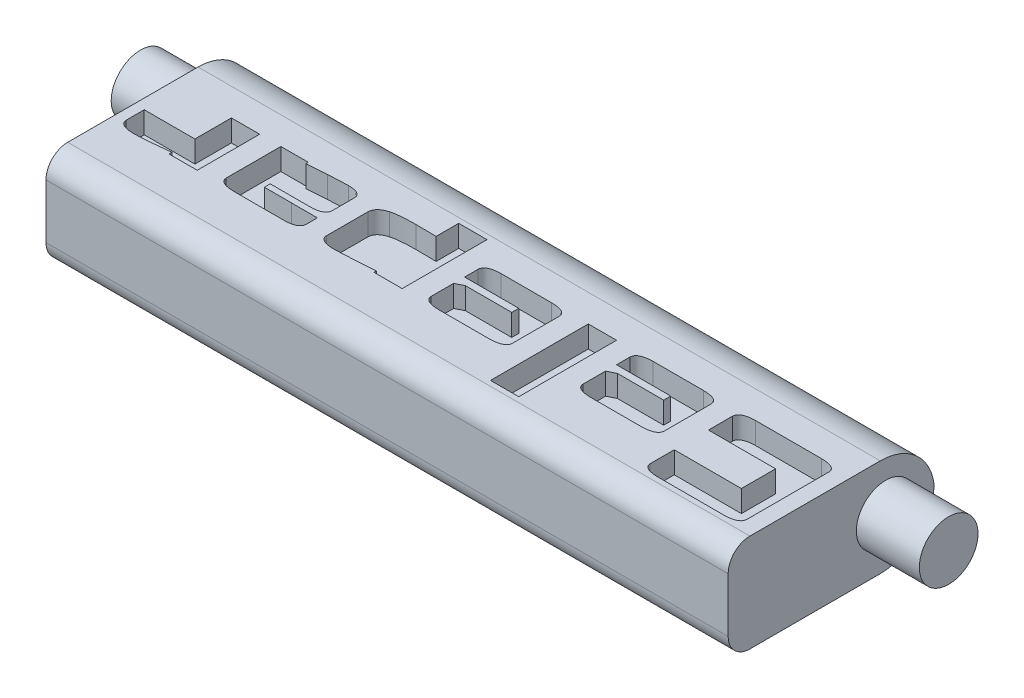
from build123d import *

# Parameters (mm, degrees)
SKETCH1_W           = 31.4
SKETCH1_H           = 9.5
BOSS_EXTRUDE1_DEPTH = 4.5
SKETCH2_R           = 1.35
BOSS_EXTRUDE2_DEPTH = 2.9
BOSS_EXTRUDE3_START = 2.9
SKETCH3_R           = 1.35
BOSS_EXTRUDE3_DEPTH = 2.9
FILLET1_R           = 1
FILLET2_R           = 2.5
SKETCH4_W           = 1.246987952
SKETCH4_H           = 0.670933735
SKETCH4_W_2         = 1.301204819
SKETCH4_H_2         = 4.5
CUT_EXTRUDE1_DEPTH  = 1
SKETCH5_W           = 1.734939759
SKETCH5_H           = 0.867469879
SKETCH5_H_2         = 0.86746988
SKETCH5_W_2         = 1.246987952
SKETCH5_H_3         = 0.670933735
SKETCH5_H_4         = 0.487951808
SKETCH5_W_3         = 1.35953898
SKETCH5_H_5         = 1.843373494
SKETCH5_H_6         = 0.93476554
SKETCH5_H_7         = 0.382440564
SKETCH5_W_4         = 1.030120482
SKETCH5_H_8         = 0.650602409
CUT_EXTRUDE2_DEPTH  = 1


with BuildPart() as part:
    # Sketch1 → Boss-Extrude1 (new body)
    with BuildSketch(Plane(origin=(0, 0, 0), x_dir=(1, 0, 0), z_dir=(0, 1, 0))):
        with Locations((15.7, 4.75)):
            Rectangle(SKETCH1_W, SKETCH1_H)
    extrude(amount=BOSS_EXTRUDE1_DEPTH)

    # Sketch2 → Boss-Extrude2 (add)
    with BuildSketch(Plane(origin=(31.4, 0, 0), x_dir=(0, 0, -1), z_dir=(1, 0, 0))):
        with Locations(Location((7.25, 2.25, 0), (0, 0, 180))):
            Circle(SKETCH2_R)
    extrude(amount=BOSS_EXTRUDE2_DEPTH)

    # Sketch3 → Boss-Extrude3 (add)
    with BuildSketch(Plane.ZY.offset(BOSS_EXTRUDE3_START)):
        with Locations((-7.25, 2.25)):
            Circle(SKETCH3_R)
    extrude(amount=-BOSS_EXTRUDE3_DEPTH)

    # Fillet1
    fillet1_edges = [part.edges().sort_by_distance(p)[0] for p in [
        (15.7, 0, 0),
        (15.7, 4.5, 0),
    ]]
    fillet(fillet1_edges, radius=FILLET1_R)

    # Fillet2
    # the kernel refuses this fillet: 2.5 mm, written as the material it takes off along each edge
    with BuildSketch(Plane(origin=(37.65, 0, -9.5), x_dir=(0, 0, 1), z_dir=(-1, 0, 0)), Plane(origin=(37.65, 4.5, -9.5), x_dir=(0, -1, 0), z_dir=(-1, 0, 0))) as fillet2_piece_1:
        with BuildLine():
            CenterArc((FILLET2_R, FILLET2_R), FILLET2_R, 180, 90)
            Line((0, FILLET2_R), (0, 0))
            Line((0, 0), (FILLET2_R, 0))
        make_face()
    extrude(amount=43.9, mode=Mode.SUBTRACT)

    # Sketch4 → Cut-Extrude1 (cut)
    # profile 1 of 7: a face of its own
    with BuildSketch(Plane(origin=(0, 4.5, 0), x_dir=(1, 0, 0), z_dir=(0, 1, 0))):
        with BuildLine():
            add(Edge.make_bspline(
                [(26.218072289, 5.382517539), (26.221243677, 5.409770477), (26.227427724, 5.462912343), (26.26504197, 5.53622592), (26.32404765, 5.597641275), (26.405137995, 5.6464264), (26.505777198, 5.686220711), (26.627818775, 5.713388683), (26.770428969, 5.73200329), (26.872558817, 5.735565362), (26.927127259, 5.737468593)],
                knots=[0, 0, 0, 0, 0.750064438, 1.462588142, 2.221300064, 3.066551887, 4.046496894, 5.188869009, 6.497999949, 8, 8, 8, 8], degree=3))
            Line((26.927127259, 5.737468593), (29.954800452, 5.737468593))
            add(Edge.make_bspline(
                [(29.954800452, 5.737468593), (30.009368893, 5.735565362), (30.111498742, 5.73200329), (30.254108936, 5.713388683), (30.376150513, 5.686220711), (30.476789715, 5.6464264), (30.557880061, 5.597641275), (30.616885741, 5.53622592), (30.654499987, 5.462912343), (30.660684034, 5.409770477), (30.663855422, 5.382517539)],
                knots=[0, 0, 0, 0, 1.502000051, 2.811130991, 3.953503106, 4.933448113, 5.778699936, 6.537411858, 7.249935562, 8, 8, 8, 8], degree=3))
            Line((30.663855422, 5.382517539), (30.663855422, 1.592419647))
            add(Edge.make_bspline(
                [(30.663855422, 1.592419647), (30.660684034, 1.565166709), (30.654499987, 1.512024842), (30.616885741, 1.438711265), (30.557880061, 1.37729591), (30.476789715, 1.328510786), (30.376150513, 1.288716474), (30.254108936, 1.261548503), (30.111498742, 1.242933896), (30.009368893, 1.239371824), (29.954800452, 1.237468593)],
                knots=[0, 0, 0, 0, 0.750064438, 1.462588142, 2.221300064, 3.066551887, 4.046496894, 5.188869009, 6.497999949, 8, 8, 8, 8], degree=3))
            Line((29.954800452, 1.237468593), (26.927127259, 1.237468593))
            add(Edge.make_bspline(
                [(26.927127259, 1.237468593), (26.872558817, 1.239371824), (26.770428969, 1.242933896), (26.627818775, 1.261548503), (26.505777198, 1.288716474), (26.405137995, 1.328510786), (26.32404765, 1.37729591), (26.26504197, 1.438711265), (26.227427724, 1.512024842), (26.221243677, 1.565166709), (26.218072289, 1.592419647)],
                knots=[0, 0, 0, 0, 1.502000051, 2.811130991, 3.953503106, 4.933448113, 5.778699936, 6.537411858, 7.249935562, 8, 8, 8, 8], degree=3))
            Line((26.218072289, 1.592419647), (26.218072289, 2.701324014))
            Line((26.218072289, 2.701324014), (27.573493976, 2.701324014))
            Line((27.573493976, 2.701324014), (27.573493976, 1.833854135))
            Line((27.573493976, 1.833854135), (29.308433735, 1.833854135))
            Line((29.308433735, 1.833854135), (29.308433735, 5.141083051))
            Line((29.308433735, 5.141083051), (27.573493976, 5.141083051))
            Line((27.573493976, 5.141083051), (27.573493976, 4.273613171))
            Line((27.573493976, 4.273613171), (26.218072289, 4.273613171))
            Line((26.218072289, 4.273613171), (26.218072289, 5.382517539))
        make_face()
    # profile 2 of 7: a face of its own
    with BuildSketch(Plane(origin=(0, 4.5, 0), x_dir=(1, 0, 0), z_dir=(0, 1, 0))):
        with BuildLine():
            add(Edge.make_bspline(
                [(21.501204819, 5.382517539), (21.504376207, 5.409770477), (21.510560254, 5.462912343), (21.5481745, 5.53622592), (21.60718018, 5.597641275), (21.688270526, 5.6464264), (21.788909728, 5.686220711), (21.910951305, 5.713388683), (22.053561499, 5.73200329), (22.155691348, 5.735565362), (22.210259789, 5.737468593)],
                knots=[0, 0, 0, 0, 0.750064438, 1.462588142, 2.221300064, 3.066551887, 4.046496894, 5.188869009, 6.497999949, 8, 8, 8, 8], degree=3))
            Line((22.210259789, 5.737468593), (24.533113705, 5.737468593))
            add(Edge.make_bspline(
                [(24.533113705, 5.737468593), (24.587682146, 5.735565362), (24.689811995, 5.73200329), (24.832422189, 5.713388683), (24.954463766, 5.686220711), (25.055102968, 5.6464264), (25.136193314, 5.597641275), (25.195198994, 5.53622592), (25.23281324, 5.462912343), (25.238997287, 5.409770477), (25.242168675, 5.382517539)],
                knots=[0, 0, 0, 0, 1.502000051, 2.811130991, 3.953503106, 4.933448113, 5.778699936, 6.537411858, 7.249935562, 8, 8, 8, 8], degree=3))
            Line((25.242168675, 5.382517539), (25.242168675, 3.218925671))
            add(Edge.make_bspline(
                [(25.242168675, 3.218925671), (25.238997287, 3.191672733), (25.23281324, 3.138530866), (25.195198994, 3.065217289), (25.136193314, 3.003801934), (25.055102968, 2.95501681), (24.954463766, 2.915222498), (24.832422189, 2.888054527), (24.689811995, 2.86943992), (24.587682146, 2.865877848), (24.533113705, 2.863974617)],
                knots=[0, 0, 0, 0, 0.750064438, 1.462588142, 2.221300064, 3.066551887, 4.046496894, 5.188869009, 6.497999949, 8, 8, 8, 8], degree=3))
            Line((24.533113705, 2.863974617), (22.210259789, 2.863974617))
            add(Edge.make_bspline(
                [(22.210259789, 2.863974617), (22.155691348, 2.865877848), (22.053561499, 2.86943992), (21.910951305, 2.888054527), (21.788909728, 2.915222498), (21.688270526, 2.95501681), (21.60718018, 3.003801934), (21.5481745, 3.065217289), (21.510560254, 3.138530866), (21.504376207, 3.191672733), (21.501204819, 3.218925671)],
                knots=[0, 0, 0, 0, 1.502000051, 2.811130991, 3.953503106, 4.933448113, 5.778699936, 6.537411858, 7.249935562, 8, 8, 8, 8], degree=3))
            Line((21.501204819, 3.218925671), (21.501204819, 4.255823261))
            Line((21.501204819, 4.255823261), (21.862932982, 4.436263773))
            Line((21.862932982, 4.436263773), (23.995180723, 4.436263773))
            Line((23.995180723, 4.436263773), (23.995180723, 5.249516786))
            Line((23.995180723, 5.249516786), (22.748192771, 5.249516786))
            Line((22.748192771, 5.249516786), (22.748192771, 4.761564978))
            Line((22.748192771, 4.761564978), (21.501204819, 4.761564978))
            Line((21.501204819, 4.761564978), (21.501204819, 5.382517539))
        make_face()
        with Locations((23.371686747, 3.687393292)):
            Rectangle(SKETCH4_W, SKETCH4_H, mode=Mode.SUBTRACT)
    # profile 3 of 7: a face of its own
    with BuildSketch(Plane(origin=(0, 4.5, 0), x_dir=(1, 0, 0), z_dir=(0, 1, 0))):
        with Locations((19.874698796, 3.487468593)):
            Rectangle(SKETCH4_W_2, SKETCH4_H_2)
    # profile 4 of 7: a face of its own
    with BuildSketch(Plane(origin=(0, 4.5, 0), x_dir=(1, 0, 0), z_dir=(0, 1, 0))):
        with BuildLine():
            add(Edge.make_bspline(
                [(14.507228916, 5.382517539), (14.510400303, 5.409770477), (14.51658435, 5.462912343), (14.554198596, 5.53622592), (14.613204277, 5.597641275), (14.694294622, 5.6464264), (14.794933824, 5.686220711), (14.916975401, 5.713388683), (15.059585596, 5.73200329), (15.161715444, 5.735565362), (15.216283886, 5.737468593)],
                knots=[0, 0, 0, 0, 0.750064438, 1.462588142, 2.221300064, 3.066551887, 4.046496894, 5.188869009, 6.497999949, 8, 8, 8, 8], degree=3))
            Line((15.216283886, 5.737468593), (17.539137801, 5.737468593))
            add(Edge.make_bspline(
                [(17.539137801, 5.737468593), (17.593706243, 5.735565362), (17.695836091, 5.73200329), (17.838446286, 5.713388683), (17.960487862, 5.686220711), (18.061127065, 5.6464264), (18.14221741, 5.597641275), (18.20122309, 5.53622592), (18.238837337, 5.462912343), (18.245021384, 5.409770477), (18.248192771, 5.382517539)],
                knots=[0, 0, 0, 0, 1.502000051, 2.811130991, 3.953503106, 4.933448113, 5.778699936, 6.537411858, 7.249935562, 8, 8, 8, 8], degree=3))
            Line((18.248192771, 5.382517539), (18.248192771, 3.218925671))
            add(Edge.make_bspline(
                [(18.248192771, 3.218925671), (18.245021384, 3.191672733), (18.238837337, 3.138530866), (18.20122309, 3.065217289), (18.14221741, 3.003801934), (18.061127065, 2.95501681), (17.960487862, 2.915222498), (17.838446286, 2.888054527), (17.695836091, 2.86943992), (17.593706243, 2.865877848), (17.539137801, 2.863974617)],
                knots=[0, 0, 0, 0, 0.750064438, 1.462588142, 2.221300064, 3.066551887, 4.046496894, 5.188869009, 6.497999949, 8, 8, 8, 8], degree=3))
            Line((17.539137801, 2.863974617), (15.216283886, 2.863974617))
            add(Edge.make_bspline(
                [(15.216283886, 2.863974617), (15.161715444, 2.865877848), (15.059585596, 2.86943992), (14.916975401, 2.888054527), (14.794933824, 2.915222498), (14.694294622, 2.95501681), (14.613204277, 3.003801934), (14.554198596, 3.065217289), (14.51658435, 3.138530866), (14.510400303, 3.191672733), (14.507228916, 3.218925671)],
                knots=[0, 0, 0, 0, 1.502000051, 2.811130991, 3.953503106, 4.933448113, 5.778699936, 6.537411858, 7.249935562, 8, 8, 8, 8], degree=3))
            Line((14.507228916, 3.218925671), (14.507228916, 4.255823261))
            Line((14.507228916, 4.255823261), (14.868957078, 4.436263773))
            Line((14.868957078, 4.436263773), (17.001204819, 4.436263773))
            Line((17.001204819, 4.436263773), (17.001204819, 5.249516786))
            Line((17.001204819, 5.249516786), (15.754216867, 5.249516786))
            Line((15.754216867, 5.249516786), (15.754216867, 4.761564978))
            Line((15.754216867, 4.761564978), (14.507228916, 4.761564978))
            Line((14.507228916, 4.761564978), (14.507228916, 5.382517539))
        make_face()
        with Locations((16.377710843, 3.687393292)):
            Rectangle(SKETCH4_W, SKETCH4_H, mode=Mode.SUBTRACT)
    # profile 5 of 7: a face of its own
    with BuildSketch(Plane(origin=(0, 4.5, 0), x_dir=(1, 0, 0), z_dir=(0, 1, 0))):
        with BuildLine():
            add(Edge.make_bspline(
                [(9.681927711, 5.141083051), (9.684473016, 5.169803781), (9.689437018, 5.225816602), (9.715998024, 5.30595032), (9.757368829, 5.378811509), (9.813633899, 5.445206631), (9.885601193, 5.503784906), (9.971593947, 5.556265692), (10.072736272, 5.600950022), (10.145909657, 5.624375221), (10.184280873, 5.636659105)],
                knots=[0, 0, 0, 0, 0.909824727, 1.774392534, 2.646544212, 3.546843563, 4.511186092, 5.570023386, 6.725750396, 8, 8, 8, 8], degree=3))
            add(Edge.make_bspline(
                [(10.184280873, 5.636659105), (10.216667134, 5.644963915), (10.284956827, 5.662475445), (10.394359972, 5.681692891), (10.515118003, 5.700217239), (10.648100433, 5.712817959), (10.792981215, 5.723816039), (10.949714942, 5.732632251), (11.118374928, 5.736255612), (11.234731953, 5.737055245), (11.294879518, 5.737468593)],
                knots=[0, 0, 0, 0, 0.717457957, 1.512832393, 2.382952487, 3.33956523, 4.379103306, 5.5021509, 6.708805593, 8, 8, 8, 8], degree=3))
            add(Edge.make_bspline(
                [(11.294879518, 5.737468593), (11.326506978, 5.737590405), (11.395696292, 5.737856885), (11.508072426, 5.735448711), (11.637976268, 5.73418702), (11.778879534, 5.73167084), (11.917796161, 5.728503299), (12.041501339, 5.728797156), (12.143139315, 5.726053126), (12.203575718, 5.726332907), (12.230120482, 5.726455792)],
                knots=[0, 0, 0, 0, 0.811520535, 1.775310121, 2.883999848, 4.14494234, 5.391395572, 6.449295368, 7.318902409, 8, 8, 8, 8], degree=3))
            Line((12.230120482, 5.726455792), (12.230120482, 6.767589075))
            Line((12.230120482, 6.767589075), (13.531325301, 6.767589075))
            Line((13.531325301, 6.767589075), (13.531325301, 2.863974617))
            Line((13.531325301, 2.863974617), (12.230120482, 2.863974617))
            Line((12.230120482, 2.863974617), (12.230120482, 2.972408352))
            add(Edge.make_bspline(
                [(12.230120482, 2.972408352), (12.076778318, 2.961818358), (11.770053627, 2.940635584), (11.463449999, 2.917767227), (11.310128012, 2.906331545)],
                knots=[0, 0, 0, 0, 0.999868408, 2, 2, 2, 2], degree=3))
            add(Edge.make_bspline(
                [(11.310128012, 2.906331545), (11.262976277, 2.902863305), (11.171239613, 2.896115628), (11.037387729, 2.887596415), (10.911135714, 2.881001645), (10.792536063, 2.875074496), (10.681580703, 2.869748915), (10.577937559, 2.866283182), (10.481913269, 2.864737527), (10.420350447, 2.864221013), (10.390982681, 2.863974617)],
                knots=[0, 0, 0, 0, 1.23296408, 2.398809114, 3.497630202, 4.52988251, 5.495581954, 6.394476552, 7.234105324, 8, 8, 8, 8], degree=3))
            add(Edge.make_bspline(
                [(10.390982681, 2.863974617), (10.336414239, 2.865877848), (10.234284391, 2.86943992), (10.091674196, 2.888054527), (9.969632619, 2.915222498), (9.868993417, 2.95501681), (9.787903072, 3.003801934), (9.728897392, 3.065217289), (9.691283145, 3.138530866), (9.685099098, 3.191672733), (9.681927711, 3.218925671)],
                knots=[0, 0, 0, 0, 1.502000051, 2.811130991, 3.953503106, 4.933448113, 5.778699936, 6.537411858, 7.249935562, 8, 8, 8, 8], degree=3))
            Line((9.681927711, 3.218925671), (9.681927711, 5.141083051))
        make_face()
        with BuildLine():
            Line((10.98313253, 4.979279587), (10.98313253, 3.406143292))
            Line((10.98313253, 3.406143292), (12.230120482, 3.406143292))
            Line((12.230120482, 3.406143292), (12.230120482, 5.195299918))
            Line((12.230120482, 5.195299918), (11.406701807, 5.195299918))
            add(Edge.make_bspline(
                [(11.406701807, 5.195299918), (11.373634124, 5.194736387), (11.311556335, 5.193678473), (11.224972267, 5.183807398), (11.151335376, 5.167553719), (11.090594853, 5.144097299), (11.042742439, 5.113709763), (11.007288968, 5.076050018), (10.986848305, 5.029649942), (10.984396681, 4.996416179), (10.98313253, 4.979279587)],
                knots=[0, 0, 0, 0, 1.499349247, 2.814720501, 3.945555396, 4.911139974, 5.753030106, 6.496525421, 7.22475135, 8, 8, 8, 8], degree=3))
        make_face(mode=Mode.SUBTRACT)
    # profile 6 of 7: a face of its own
    with BuildSketch(Plane(origin=(0, 4.5, 0), x_dir=(1, 0, 0), z_dir=(0, 1, 0))):
        with BuildLine():
            Line((5.073493976, 5.737468593), (6.331494729, 5.737468593))
            Line((6.331494729, 5.737468593), (6.331494729, 5.629034858))
            add(Edge.make_bspline(
                [(6.331494729, 5.629034858), (6.487372876, 5.63998257), (6.799430227, 5.661899139), (7.111431629, 5.684598282), (7.267582831, 5.695958804)],
                knots=[0, 0, 0, 0, 0.999035255, 2, 2, 2, 2], degree=3))
            add(Edge.make_bspline(
                [(7.267582831, 5.695958804), (7.316997852, 5.699087432), (7.412716433, 5.705147693), (7.551931462, 5.713592868), (7.681801382, 5.72138463), (7.802660656, 5.727477923), (7.9142266, 5.731391818), (8.016713951, 5.735185603), (8.109916902, 5.736688218), (8.168938098, 5.737217768), (8.196893825, 5.737468593)],
                knots=[0, 0, 0, 0, 1.277248827, 2.474074539, 3.597753647, 4.63336449, 5.595566971, 6.477435299, 7.278828509, 8, 8, 8, 8], degree=3))
            add(Edge.make_bspline(
                [(8.196893825, 5.737468593), (8.244125827, 5.735530773), (8.333041973, 5.731882748), (8.457140753, 5.713480319), (8.563741962, 5.685894466), (8.651438535, 5.64602658), (8.722408248, 5.596800183), (8.772777723, 5.534614431), (8.806585805, 5.462371297), (8.811776049, 5.409721513), (8.814457831, 5.382517539)],
                knots=[0, 0, 0, 0, 1.435333223, 2.702072664, 3.805190089, 4.768726751, 5.616486771, 6.403039614, 7.174855684, 8, 8, 8, 8], degree=3))
            Line((8.814457831, 5.382517539), (8.814457831, 4.357479888))
            add(Edge.make_bspline(
                [(8.814457831, 4.357479888), (8.811819793, 4.330268124), (8.806702803, 4.277485595), (8.771936848, 4.204756911), (8.718691898, 4.143182369), (8.64521566, 4.093750889), (8.554277148, 4.054198477), (8.44413353, 4.026444654), (8.315512276, 4.008070569), (8.223226279, 4.004456036), (8.174021084, 4.002528834)],
                knots=[0, 0, 0, 0, 0.804248023, 1.559996011, 2.342741836, 3.189471187, 4.159086663, 5.266561659, 6.542580998, 8, 8, 8, 8], degree=3))
            Line((8.174021084, 4.002528834), (6.320481928, 4.002528834))
            Line((6.320481928, 4.002528834), (6.320481928, 3.351926424))
            Line((6.320481928, 3.351926424), (7.56746988, 3.351926424))
            Line((7.56746988, 3.351926424), (7.56746988, 3.731444496))
            Line((7.56746988, 3.731444496), (8.760240964, 3.731444496))
            Line((8.760240964, 3.731444496), (8.760240964, 3.218925671))
            add(Edge.make_bspline(
                [(8.760240964, 3.218925671), (8.757237864, 3.191732982), (8.751417483, 3.139030164), (8.716967928, 3.065938492), (8.662548291, 3.00435628), (8.587488712, 2.955271468), (8.494453974, 2.915336714), (8.38164456, 2.888094788), (8.250003822, 2.869443049), (8.155741284, 2.865878285), (8.105402861, 2.863974617)],
                knots=[0, 0, 0, 0, 0.793056325, 1.537041893, 2.312994797, 3.160093703, 4.129691991, 5.251786666, 6.53238912, 8, 8, 8, 8], degree=3))
            Line((8.105402861, 2.863974617), (5.782548946, 2.863974617))
            add(Edge.make_bspline(
                [(5.782548946, 2.863974617), (5.727980504, 2.865877848), (5.625850656, 2.86943992), (5.483240461, 2.888054527), (5.361198885, 2.915222498), (5.260559682, 2.95501681), (5.179469337, 3.003801934), (5.120463657, 3.065217289), (5.08284941, 3.138530866), (5.076665363, 3.191672733), (5.073493976, 3.218925671)],
                knots=[0, 0, 0, 0, 1.502000051, 2.811130991, 3.953503106, 4.933448113, 5.778699936, 6.537411858, 7.249935562, 8, 8, 8, 8], degree=3))
            Line((5.073493976, 3.218925671), (5.073493976, 5.737468593))
        make_face()
        Polygon((6.320481928, 5.222408352), (6.320481928, 4.436263773), (7.56746988, 4.436263773), (7.56746988, 5.249516786), align=None, mode=Mode.SUBTRACT)
    # profile 7 of 7: a face of its own
    with BuildSketch(Plane(origin=(0, 4.5, 0), x_dir=(1, 0, 0), z_dir=(0, 1, 0))):
        with BuildLine():
            Line((0.465060241, 4.056745701), (1.76626506, 4.056745701))
            Line((1.76626506, 4.056745701), (1.76626506, 3.406143292))
            Line((1.76626506, 3.406143292), (2.796385542, 3.4129204))
            Line((2.796385542, 3.4129204), (2.796385542, 5.737468593))
            Line((2.796385542, 5.737468593), (4.097590361, 5.737468593))
            Line((4.097590361, 5.737468593), (4.097590361, 2.863974617))
            Line((4.097590361, 2.863974617), (2.796385542, 2.863974617))
            Line((2.796385542, 2.863974617), (2.796385542, 2.999516786))
            add(Edge.make_bspline(
                [(2.796385542, 2.999516786), (2.661413984, 2.985060159), (2.392058854, 2.956209884), (2.122633813, 2.928019977), (1.988215361, 2.913955792)],
                knots=[0, 0, 0, 0, 1.002182942, 2, 2, 2, 2], degree=3))
            add(Edge.make_bspline(
                [(1.988215361, 2.913955792), (1.910312664, 2.906214609), (1.761414515, 2.891418616), (1.547837168, 2.876510174), (1.354369543, 2.866385109), (1.232013798, 2.864748879), (1.174115211, 2.863974617)],
                knots=[0, 0, 0, 0, 1.151291896, 2.200504451, 3.148480928, 4, 4, 4, 4], degree=3))
            add(Edge.make_bspline(
                [(1.174115211, 2.863974617), (1.119546769, 2.865877848), (1.017416921, 2.86943992), (0.874806726, 2.888054527), (0.75276515, 2.915222498), (0.652125947, 2.95501681), (0.571035602, 3.003801934), (0.512029922, 3.065217289), (0.474415675, 3.138530866), (0.468231628, 3.191672733), (0.465060241, 3.218925671)],
                knots=[0, 0, 0, 0, 1.502000051, 2.811130991, 3.953503106, 4.933448113, 5.778699936, 6.537411858, 7.249935562, 8, 8, 8, 8], degree=3))
            Line((0.465060241, 3.218925671), (0.465060241, 4.056745701))
        make_face()
    extrude(amount=-CUT_EXTRUDE1_DEPTH, mode=Mode.SUBTRACT)

    # Sketch5 → Cut-Extrude2 (cut)
    with BuildSketch(Plane(origin=(0, 4.5, 0), x_dir=(1, 0, 0), z_dir=(0, 1, 0))):
        with Locations((28.440963856, 2.267589075)):
            Rectangle(SKETCH5_W, SKETCH5_H)
        with Locations((28.440963856, 4.707348111)):
            Rectangle(SKETCH5_W, SKETCH5_H_2)
        with Locations((23.371686747, 3.687393292)):
            Rectangle(SKETCH5_W_2, SKETCH5_H_3)
        with Locations((23.371686747, 5.005540882)):
            Rectangle(SKETCH5_W_2, SKETCH5_H_4)
        with Locations((16.377710843, 5.005540882)):
            Rectangle(SKETCH5_W_2, SKETCH5_H_4)
        with Locations((16.377710843, 3.687393292)):
            Rectangle(SKETCH5_W_2, SKETCH5_H_3)
        with Locations((11.550350992, 4.327830039)):
            Rectangle(SKETCH5_W_3, SKETCH5_H_5)
        with Locations((6.943975904, 4.903646543)):
            Rectangle(SKETCH5_W_2, SKETCH5_H_6)
        with Locations((6.943975904, 3.543146706)):
            Rectangle(SKETCH5_W_2, SKETCH5_H_7)
        with Locations((2.281325301, 3.731444497)):
            Rectangle(SKETCH5_W_4, SKETCH5_H_8)
    extrude(amount=-CUT_EXTRUDE2_DEPTH, mode=Mode.SUBTRACT)


solid = part.part
